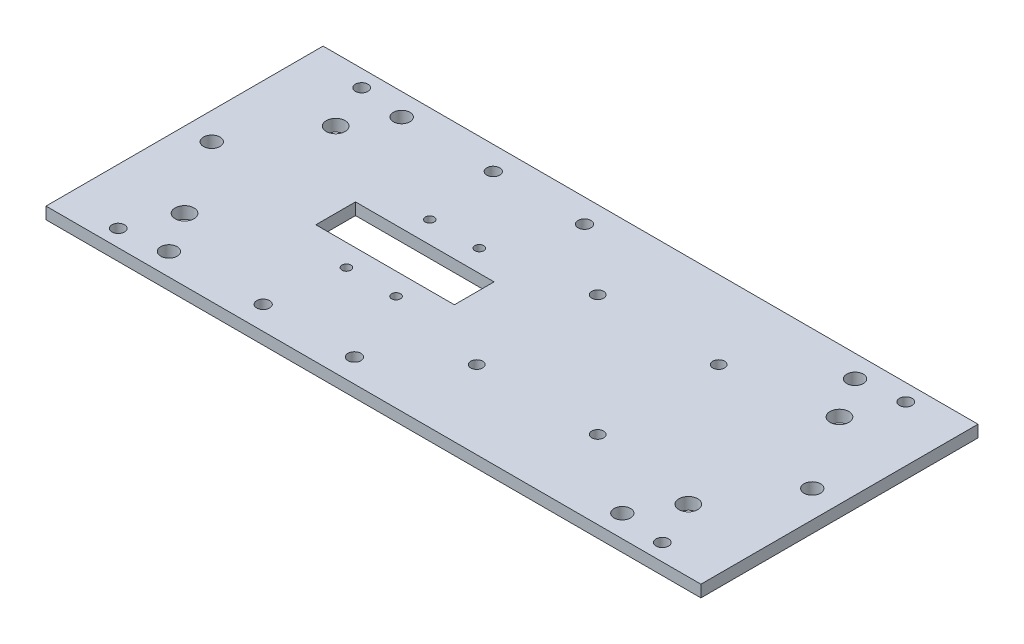
from build123d import *

# Parameters (mm, degrees)
SKETCH1_W           = 165.1
SKETCH1_H           = 69.85
BOSS_EXTRUDE1_DEPTH = 3
CUT_EXTRUDE1_REACH  = 91.684
SKETCH6_W           = 34.925
SKETCH6_H           = 10
SKETCH6_R           = 1.5
SKETCH6_R_2         = 1.625
CUT_EXTRUDE3_REACH  = 91.684
SKETCH8_R           = 2.38125
SKETCH9_R           = 2.0828
CUT_EXTRUDE5_DEPTH  = 5.08
SKETCH10_R          = 2.0828
CUT_EXTRUDE6_DEPTH  = 5.08
SKETCH11_R          = 1.125
SKETCH11_R_2        = 1.125000036
CUT_EXTRUDE7_DEPTH  = 41.91
SKETCH13_R          = 1.5875
CUT_EXTRUDE10_DEPTH = 28.034


with BuildPart() as part:
    # Sketch1 → Boss-Extrude1 (new body)
    with BuildSketch(Plane(origin=(0, 0, 0), x_dir=(1, 0, 0), z_dir=(0, 1, 0))):
        Rectangle(SKETCH1_W, SKETCH1_H)
    extrude(amount=BOSS_EXTRUDE1_DEPTH)

    # Sketch6 → Cut-Extrude1 (cut, up to next)
    with BuildSketch(Plane.XZ, mode=Mode.PRIVATE) as cut_extrude1_sk1:
        with Locations((-26.9875, 0)):
            Rectangle(SKETCH6_W, SKETCH6_H)
    cut_extrude1_tool1 = extrude(cut_extrude1_sk1.sketch, amount=-CUT_EXTRUDE1_REACH, mode=Mode.PRIVATE) & part.part
    # Sketch6 → Cut-Extrude1 (cut, up to next)
    with BuildSketch(Plane.XZ, mode=Mode.PRIVATE) as cut_extrude1_sk2:
        with Locations((6.35, 15.25)):
            Circle(SKETCH6_R)
    cut_extrude1_tool2 = extrude(cut_extrude1_sk2.sketch, amount=-CUT_EXTRUDE1_REACH, mode=Mode.PRIVATE) & part.part
    # Sketch6 → Cut-Extrude1 (cut, up to next)
    with BuildSketch(Plane.XZ, mode=Mode.PRIVATE) as cut_extrude1_sk3:
        with Locations((36.85, 15.25)):
            Circle(SKETCH6_R)
    cut_extrude1_tool3 = extrude(cut_extrude1_sk3.sketch, amount=-CUT_EXTRUDE1_REACH, mode=Mode.PRIVATE) & part.part
    # Sketch6 → Cut-Extrude1 (cut, up to next)
    with BuildSketch(Plane.XZ, mode=Mode.PRIVATE) as cut_extrude1_sk4:
        with Locations((6.35, -15.25)):
            Circle(SKETCH6_R)
    cut_extrude1_tool4 = extrude(cut_extrude1_sk4.sketch, amount=-CUT_EXTRUDE1_REACH, mode=Mode.PRIVATE) & part.part
    # Sketch6 → Cut-Extrude1 (cut, up to next)
    with BuildSketch(Plane.XZ, mode=Mode.PRIVATE) as cut_extrude1_sk5:
        with Locations((36.85, -15.25)):
            Circle(SKETCH6_R)
    cut_extrude1_tool5 = extrude(cut_extrude1_sk5.sketch, amount=-CUT_EXTRUDE1_REACH, mode=Mode.PRIVATE) & part.part
    # Sketch6 → Cut-Extrude1 (cut, up to next)
    with BuildSketch(Plane.XZ, mode=Mode.PRIVATE) as cut_extrude1_sk6:
        with Locations((-33.725993, 29.000000039)):
            Circle(SKETCH6_R_2)
    cut_extrude1_tool6 = extrude(cut_extrude1_sk6.sketch, amount=-CUT_EXTRUDE1_REACH, mode=Mode.PRIVATE) & part.part
    # Sketch6 → Cut-Extrude1 (cut, up to next)
    with BuildSketch(Plane.XZ, mode=Mode.PRIVATE) as cut_extrude1_sk7:
        with Locations((-10.724007, 29.000000039)):
            Circle(SKETCH6_R_2)
    cut_extrude1_tool7 = extrude(cut_extrude1_sk7.sketch, amount=-CUT_EXTRUDE1_REACH, mode=Mode.PRIVATE) & part.part
    # Sketch6 → Cut-Extrude1 (cut, up to next)
    with BuildSketch(Plane.XZ, mode=Mode.PRIVATE) as cut_extrude1_sk8:
        with Locations((-10.724007, -29.000000039)):
            Circle(SKETCH6_R_2)
    cut_extrude1_tool8 = extrude(cut_extrude1_sk8.sketch, amount=-CUT_EXTRUDE1_REACH, mode=Mode.PRIVATE) & part.part
    # Sketch6 → Cut-Extrude1 (cut, up to next)
    with BuildSketch(Plane.XZ, mode=Mode.PRIVATE) as cut_extrude1_sk9:
        with Locations((-33.725993, -29.000000039)):
            Circle(SKETCH6_R_2)
    cut_extrude1_tool9 = extrude(cut_extrude1_sk9.sketch, amount=-CUT_EXTRUDE1_REACH, mode=Mode.PRIVATE) & part.part
    add(cut_extrude1_tool1.solids().sort_by_distance((-26.9875, 0, 0))[0], mode=Mode.SUBTRACT)
    add(cut_extrude1_tool2.solids().sort_by_distance((6.35, 0, 15.25))[0], mode=Mode.SUBTRACT)
    add(cut_extrude1_tool3.solids().sort_by_distance((36.85, 0, 15.25))[0], mode=Mode.SUBTRACT)
    add(cut_extrude1_tool4.solids().sort_by_distance((6.35, 0, -15.25))[0], mode=Mode.SUBTRACT)
    add(cut_extrude1_tool5.solids().sort_by_distance((36.85, 0, -15.25))[0], mode=Mode.SUBTRACT)
    add(cut_extrude1_tool6.solids().sort_by_distance((-33.725993, 0, 29))[0], mode=Mode.SUBTRACT)
    add(cut_extrude1_tool7.solids().sort_by_distance((-10.724007, 0, 29))[0], mode=Mode.SUBTRACT)
    add(cut_extrude1_tool8.solids().sort_by_distance((-10.724007, 0, -29))[0], mode=Mode.SUBTRACT)
    add(cut_extrude1_tool9.solids().sort_by_distance((-33.725993, 0, -29))[0], mode=Mode.SUBTRACT)

    # Sketch8 → Cut-Extrude3 (cut, up to next)
    with BuildSketch(Plane(origin=(0, 3, 0), x_dir=(1, 0, 0), z_dir=(0, 1, 0)), mode=Mode.PRIVATE) as cut_extrude3_sk1:
        with Locations((-63.5, -19.05)):
            Circle(SKETCH8_R)
    cut_extrude3_tool1 = extrude(cut_extrude3_sk1.sketch, amount=-CUT_EXTRUDE3_REACH, mode=Mode.PRIVATE) & part.part
    # Sketch8 → Cut-Extrude3 (cut, up to next)
    with BuildSketch(Plane(origin=(0, 3, 0), x_dir=(1, 0, 0), z_dir=(0, 1, 0)), mode=Mode.PRIVATE) as cut_extrude3_sk2:
        with Locations((-63.5, 19.05)):
            Circle(SKETCH8_R)
    cut_extrude3_tool2 = extrude(cut_extrude3_sk2.sketch, amount=-CUT_EXTRUDE3_REACH, mode=Mode.PRIVATE) & part.part
    # Sketch8 → Cut-Extrude3 (cut, up to next)
    with BuildSketch(Plane(origin=(0, 3, 0), x_dir=(1, 0, 0), z_dir=(0, 1, 0)), mode=Mode.PRIVATE) as cut_extrude3_sk3:
        with Locations((63.5, 19.05)):
            Circle(SKETCH8_R)
    cut_extrude3_tool3 = extrude(cut_extrude3_sk3.sketch, amount=-CUT_EXTRUDE3_REACH, mode=Mode.PRIVATE) & part.part
    # Sketch8 → Cut-Extrude3 (cut, up to next)
    with BuildSketch(Plane(origin=(0, 3, 0), x_dir=(1, 0, 0), z_dir=(0, 1, 0)), mode=Mode.PRIVATE) as cut_extrude3_sk4:
        with Locations((63.5, -19.05)):
            Circle(SKETCH8_R)
    cut_extrude3_tool4 = extrude(cut_extrude3_sk4.sketch, amount=-CUT_EXTRUDE3_REACH, mode=Mode.PRIVATE) & part.part
    add(cut_extrude3_tool1.solids().sort_by_distance((-63.5, 3, 19.05))[0], mode=Mode.SUBTRACT)
    add(cut_extrude3_tool2.solids().sort_by_distance((-63.5, 3, -19.05))[0], mode=Mode.SUBTRACT)
    add(cut_extrude3_tool3.solids().sort_by_distance((63.5, 3, -19.05))[0], mode=Mode.SUBTRACT)
    add(cut_extrude3_tool4.solids().sort_by_distance((63.5, 3, 19.05))[0], mode=Mode.SUBTRACT)

    # Sketch9 → Cut-Extrude5 (cut)
    with BuildSketch(Plane(origin=(0, 3, 0), x_dir=(1, 0, 0), z_dir=(0, 1, 0))):
        with Locations((-75.692, 0)):
            Circle(SKETCH9_R)
        with Locations((75.692, 0)):
            Circle(SKETCH9_R)
    extrude(amount=-CUT_EXTRUDE5_DEPTH, mode=Mode.SUBTRACT)

    # Sketch10 → Cut-Extrude6 (cut)
    with BuildSketch(Plane(origin=(0, 3, 0), x_dir=(1, 0, 0), z_dir=(0, 1, 0))):
        with Locations((57.15, -29.337)):
            Circle(SKETCH10_R)
        with Locations((57.15, 29.337)):
            Circle(SKETCH10_R)
        with Locations((-57.15, -29.337)):
            Circle(SKETCH10_R)
        with Locations((-57.15, 29.337)):
            Circle(SKETCH10_R)
    extrude(amount=-CUT_EXTRUDE6_DEPTH, mode=Mode.SUBTRACT)

    # Sketch11 → Cut-Extrude7 (cut)
    with BuildSketch(Plane(origin=(0, 3, 0), x_dir=(1, 0, 0), z_dir=(0, 1, 0))):
        with Locations((-31.2375, 10.5)):
            Circle(SKETCH11_R)
        with Locations((-18.7375, 10.5)):
            Circle(SKETCH11_R_2)
        with Locations((-18.7375, -10.5)):
            Circle(SKETCH11_R_2)
        with Locations((-31.2375, -10.5)):
            Circle(SKETCH11_R_2)
    extrude(amount=-CUT_EXTRUDE7_DEPTH, mode=Mode.SUBTRACT)

    # Sketch13 → Cut-Extrude10 (cut)
    with BuildSketch(Plane.XZ):
        with Locations((-68.580370043, 30.689580758)):
            Circle(SKETCH13_R)
        with Locations((-68.580370043, -30.689580758)):
            Circle(SKETCH13_R)
        with Locations((68.580370043, -30.689580758)):
            Circle(SKETCH13_R)
        with Locations((68.580370043, 30.689580758)):
            Circle(SKETCH13_R)
    extrude(amount=-CUT_EXTRUDE10_DEPTH, mode=Mode.SUBTRACT)


solid = part.part
